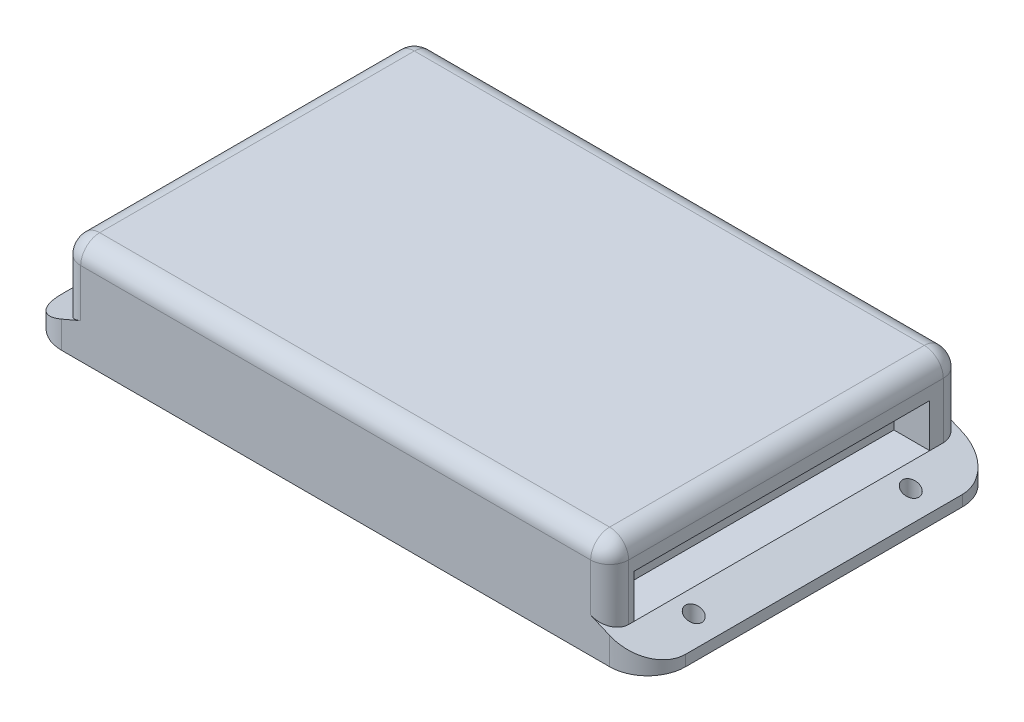
from build123d import *

# Parameters (mm, degrees)
SKETCH1_W           = 115
SKETCH1_H           = 65
BOSS_EXTRUDE1_DEPTH = 5
SKETCH2_R           = 1.5
CUT_EXTRUDE1_DEPTH  = 67.238206497
CHAMFER1_SIZE       = 3
CHAMFER1_SIZE_2     = 7
FILLET1_R           = 7
SKETCH3_W           = 101
SKETCH3_H           = 65
BOSS_EXTRUDE2_DEPTH = 13.8
FILLET2_R           = 3.5
SKETCH4_W           = 26
SKETCH4_H           = 8
CUT_EXTRUDE2_DEPTH  = 6.6
SKETCH5_W           = 54.5
SKETCH5_H           = 8
CUT_EXTRUDE3_DEPTH  = 6.6


# Some blends are built 0.0001 mm under size
with BuildPart() as part:
    # Sketch1 → Boss-Extrude1 (new body)
    with BuildSketch(Plane(origin=(0, 0, 0), x_dir=(1, 0, 0), z_dir=(0, 1, 0))):
        Rectangle(SKETCH1_W, SKETCH1_H)
    extrude(amount=BOSS_EXTRUDE1_DEPTH)

    # Sketch2 → Cut-Extrude1 (cut, through all)
    with BuildSketch(Plane(origin=(0, 5, 0), x_dir=(1, 0, 0), z_dir=(0, 1, 0))):
        with Locations(Location((53.5, 20, 0), (0, 0, 270))):
            Circle(SKETCH2_R)
        with Locations(Location((53.5, -20, 0), (0, 0, 270))):
            Circle(SKETCH2_R)
    cut_extrude1 = extrude(amount=-CUT_EXTRUDE1_DEPTH, mode=Mode.SUBTRACT)

    # Mirror16: Cut-Extrude1 across plane
    add(cut_extrude1.mirror(Plane(origin=(0, 0, 0), x_dir=(0, 0, 1), z_dir=(1, 0, 0))), mode=Mode.SUBTRACT)

    # Chamfer1
    # the kernel refuses this chamfer: 7, 3 mm, written as the material it takes off along each edge
    with BuildSketch(Plane(origin=(-57.5, 5, -50.645496776), x_dir=(-0.08246287738523231, -0.9965941369752023, 0), z_dir=(0, 0, 1)), Plane(origin=(57.5, 5, 50.645496776), x_dir=(0.08246287738523231, -0.9965941369752023, 0), z_dir=(0, 0, -1))) as chamfer1_piece_1:
        Polygon((CHAMFER1_SIZE * 0.996594136975, CHAMFER1_SIZE * 0.0824628773852), (-CHAMFER1_SIZE_2 * 0.0824628773852, CHAMFER1_SIZE_2 * 0.996594136975), (0, 0), align=None)
    extrude(amount=101.290993551, mode=Mode.SUBTRACT)

    # Fillet1
    fillet1_edges = [part.edges().sort_by_distance(p)[0] for p in [
        (57.5, 1, -32.5),
        (57.5, 1, 32.5),
        (-57.5, 1, -32.5),
        (-57.5, 1, 32.5),
    ]]
    fillet(fillet1_edges, radius=FILLET1_R - 0.0001)  # a hair under: the kernel refuses the full size

    # Sketch3 → Boss-Extrude2 (add)
    with BuildSketch(Plane(origin=(0, 5, 0), x_dir=(1, 0, 0), z_dir=(0, 1, 0))):
        Rectangle(SKETCH3_W, SKETCH3_H)
    extrude(amount=BOSS_EXTRUDE2_DEPTH)

    # Fillet2
    fillet2_edges = [part.edges().sort_by_distance(p)[0] for p in [
        (0, 18.8, 32.5),
        (-50.5, 11.9, 32.5),
        (-50.5, 18.8, 0),
        (-50.5, 11.9, -32.5),
        (0, 18.8, -32.5),
        (50.5, 11.9, -32.5),
        (50.5, 18.8, 0),
        (50.5, 11.9, 32.5),
    ]]
    fillet(fillet2_edges, radius=FILLET2_R)

    # Sketch4 → Cut-Extrude2 (cut)
    with BuildSketch(Plane.ZY.offset(50.5)):
        with Locations((-0.5, 9)):
            Rectangle(SKETCH4_W, SKETCH4_H)
    extrude(amount=-CUT_EXTRUDE2_DEPTH, mode=Mode.SUBTRACT)

    # Sketch5 → Cut-Extrude3 (cut)
    with BuildSketch(Plane(origin=(50.5, 0, 0), x_dir=(0, 0, -1), z_dir=(1, 0, 0))):
        with Locations((-0.75, 9)):
            Rectangle(SKETCH5_W, SKETCH5_H)
    extrude(amount=-CUT_EXTRUDE3_DEPTH, mode=Mode.SUBTRACT)


solid = part.part
